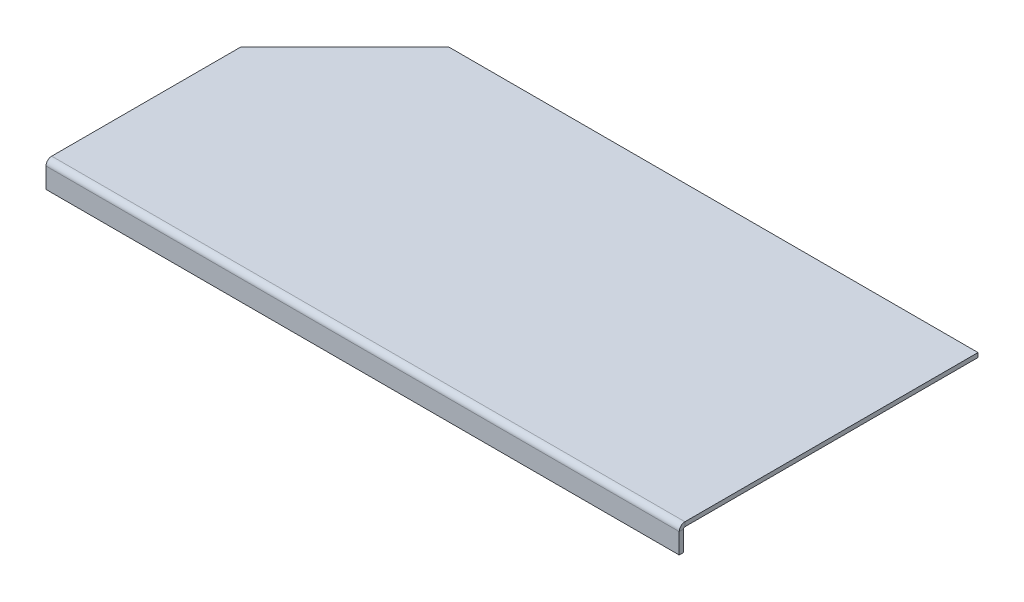
from build123d import *

# Parameters (mm, degrees)
SKETCH2_W                    = 464.185
SKETCH2_H                    = 127.5715
BASE_FLANGE1_DEPTH           = 3.175
BOSS_EXTRUDE1_DEPTH          = 3.175
EDGE_FLANGE1_STRIP_W         = 17.24
EDGE_FLANGE1_STRIP_H         = 3.175
EDGE_FLANGE1_STRIP_CUT_DEPTH = 464.185
EDGE_FLANGE1_DEPTH           = 464.185


# Sheet-metal steps are written as plain solids
with BuildPart() as part:
    # Sketch2 → Base-Flange1 (new body)
    with BuildSketch(Plane(origin=(0, 0, 0), x_dir=(1, 0, 0), z_dir=(0, 1, 0))):
        Rectangle(SKETCH2_W, SKETCH2_H)
    extrude(amount=-BASE_FLANGE1_DEPTH)

    # Sketch7 → Boss-Extrude1 (add)
    with BuildSketch(Plane(origin=(0, 0, 0), x_dir=(1, 0, 0), z_dir=(0, 1, 0))):
        Polygon((-232.0925, 63.78575), (232.0925, 63.78575), (232.0925, 152.68575), (-155.8925, 152.68575), (-232.0925, 76.48575), align=None)
    extrude(amount=-BOSS_EXTRUDE1_DEPTH)

    # Edge-Flange1 strip (across the edge) → Edge-Flange1 strip cut (cut)
    with BuildSketch(Plane(origin=(232.0925, -3.175, 66.32575), x_dir=(0, 0, -1), z_dir=(-1, 0, 0))):
        with Locations((-4.445, -1.5875)):
            Rectangle(EDGE_FLANGE1_STRIP_W, EDGE_FLANGE1_STRIP_H)
    extrude(amount=EDGE_FLANGE1_STRIP_CUT_DEPTH, mode=Mode.SUBTRACT)

    # Edge-Flange1 section (across the edge) → Edge-Flange1 (add)
    with BuildSketch(Plane(origin=(232.0925, -3.175, 66.32575), x_dir=(0, 0, -1), z_dir=(-1, 0, 0))):
        with BuildLine():
            Line((0, 1), (0, 15.875))
            Line((0, 15.875), (3.175, 15.875))
            Line((3.175, 15.875), (3.175, 1))
            ThreePointArc((3.175, 1), (3.467893219, 0.292893219), (4.175, 0))
            Line((4.175, 0), (4.175, -3.175))
            ThreePointArc((4.175, -3.175), (1.222829189, -1.952170811), (0, 1))
        make_face()
    extrude(amount=EDGE_FLANGE1_DEPTH)


solid = part.part
